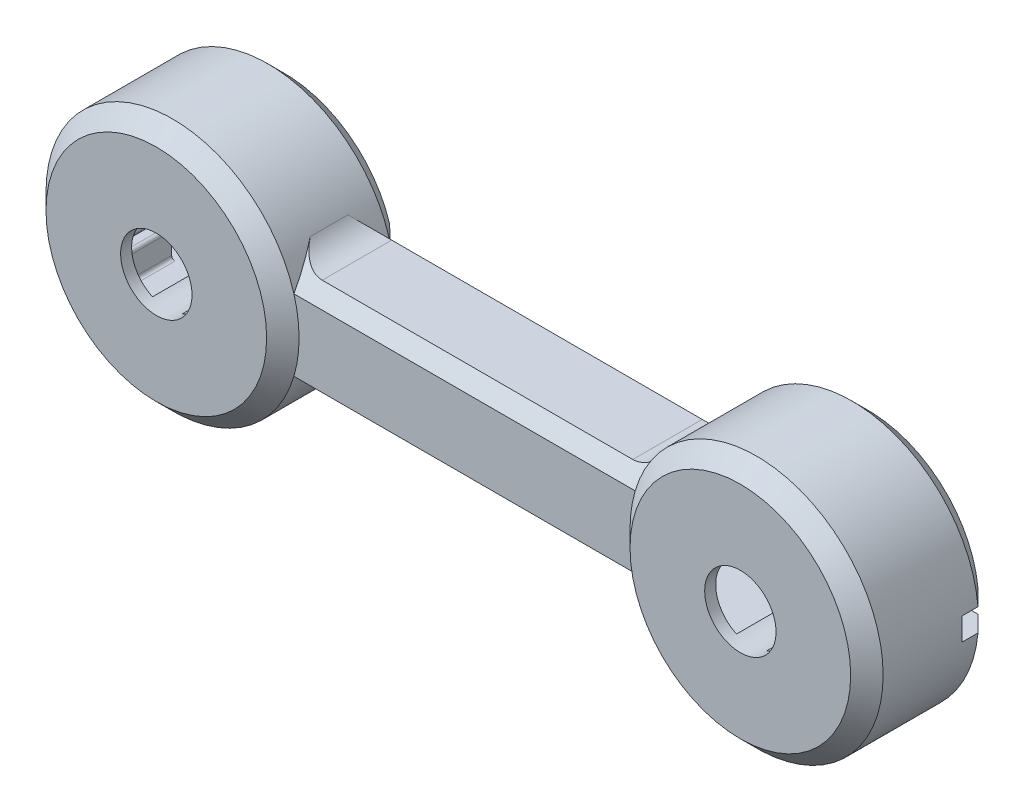
from build123d import *

# Parameters (mm, degrees)
SKETCH1_R               = 11
BOSS_EXTRUDE1_DEPTH     = 29.4
SKETCH2_R               = 11
BOSS_EXTRUDE2_DEPTH     = 5
SKETCH4_W               = 71
SKETCH4_H               = 20
CUT_EXTRUDE1_DEPTH      = 18
SKETCH5_R               = 2.25
CUT_EXTRUDE2_DEPTH      = 5
BOSS_EXTRUDE3_START     = 5
BOSS_EXTRUDE3_DEPTH     = 5
CUT_EXTRUDE3_DEPTH      = 106.704115341
CUT_EXTRUDE3_DEPTH_BACK = 10
CHAMFER1_SIZE           = 4
FILLET2_R               = 10
CUT_EXTRUDE4_DEPTH      = 13
FILLET3_R               = 1
SKETCH11_R              = 1.5
CUT_EXTRUDE5_DEPTH      = 10


with BuildPart() as part:
    # Sketch1 → Boss-Extrude1 (new body)
    with BuildSketch(Plane.XY):
        with BuildLine():
            Line((36, -15), (90, -15))
            Line((90, -15), (90, 15))
            Line((90, 15), (36, 15))
            ThreePointArc((36, 15), (-39, 0), (36, -15))
        make_face()
        Circle(SKETCH1_R, mode=Mode.SUBTRACT)
    extrude(amount=BOSS_EXTRUDE1_DEPTH)

    # Sketch2 → Boss-Extrude2 (add)
    with BuildSketch(Plane.XY.offset(29.4)):
        with BuildLine():
            ThreePointArc((36, 15), (-39, 0), (36, -15))
            ThreePointArc((36, -15), (39, 0), (36, 15))
        make_face()
        Circle(SKETCH2_R, mode=Mode.SUBTRACT)
    extrude(amount=BOSS_EXTRUDE2_DEPTH)

    # Sketch4 → Cut-Extrude1 (cut)
    with BuildSketch(Plane(origin=(0, 0, 0), x_dir=(-1, 0, 0), z_dir=(0, 0, -1))):
        with Locations((-7.5, 0)):
            Rectangle(SKETCH4_W, SKETCH4_H)
    extrude(amount=-CUT_EXTRUDE1_DEPTH, mode=Mode.SUBTRACT)

    # Sketch5 → Cut-Extrude2 (cut)
    with BuildSketch(Plane(origin=(0, 0, 18), x_dir=(-1, 0, 0), z_dir=(0, 0, -1))):
        with Locations((-34.85, 5)):
            Circle(SKETCH5_R)
        with Locations(Location((14.65, 5, 0), (0, 0, 180))):
            Circle(SKETCH5_R)
        with Locations((14.65, -5)):
            Circle(SKETCH5_R)
        with Locations(Location((-34.85, -5, 0), (0, 0, 180))):
            Circle(SKETCH5_R)
    extrude(amount=-CUT_EXTRUDE2_DEPTH, mode=Mode.SUBTRACT)

    # Sketch8 → Boss-Extrude3 (add)
    with BuildSketch(Plane(origin=(0, 0, 0), x_dir=(-1, 0, 0), z_dir=(0, 0, -1)).offset(BOSS_EXTRUDE3_START)):
        with BuildLine():
            Line((-4.582575695, -10), (-37.69615365, -10))
            ThreePointArc((-37.69615365, -10), (-36.932787137, -12.528736341), (-36, -15))
            ThreePointArc((-36, -15), (39, 0), (-36, 15))
            ThreePointArc((-36, 15), (-36.932787137, 12.528736341), (-37.69615365, 10))
            Line((-37.69615365, 10), (-4.582575695, 10))
            ThreePointArc((-4.582575695, 10), (0, 11), (4.582575695, 10))
            Line((4.582575695, 10), (28, 10))
            Line((28, 10), (28, -10))
            Line((28, -10), (4.582575695, -10))
            ThreePointArc((4.582575695, -10), (0, -11), (-4.582575695, -10))
        make_face()
    extrude(amount=-BOSS_EXTRUDE3_DEPTH)

    # Sketch9 → Cut-Extrude3 (cut, two sides: drawn at the far end of the back side and taken through both)
    with BuildSketch(Plane(origin=(0, 0, -5), x_dir=(-1, 0, 0), z_dir=(0, 0, -1)).offset(-CUT_EXTRUDE3_DEPTH_BACK)):
        with BuildLine():
            Line((38.842631219, 3.5), (28, 3.5))
            Line((28, 3.5), (28, -3.5))
            Line((28, -3.5), (38.842631219, -3.5))
            ThreePointArc((38.842631219, -3.5), (39, 0), (38.842631219, 3.5))
        make_face()
    extrude(amount=CUT_EXTRUDE3_DEPTH + CUT_EXTRUDE3_DEPTH_BACK, mode=Mode.SUBTRACT)

    # Sketch7 → Cut-Revolve1 (revolve, cut)
    with BuildSketch(Plane(origin=(0, 0, 0), x_dir=(1, 0, 0), z_dir=(0, 1, 0)), mode=Mode.PRIVATE) as cut_revolve1_sk:
        Polygon((-39, 0), (-34, 5), (-39, 5), align=None)
        Polygon((-39, -29.4), (-34, -34.4), (-39, -34.4), align=None)
    revolve(cut_revolve1_sk.sketch.rotate(Axis((0, 0, 0), (0, 0, 1)), 65.380022671), axis=Axis((0, 0, 0), (0, 0, 1)), mode=Mode.SUBTRACT)

    # Chamfer1
    # the kernel refuses this chamfer: 4 mm, written as the material it takes off along each edge
    with BuildSketch(Plane(origin=(25.713268048, -15, 29.4), x_dir=(0, -0.027495876610586487, -0.9996219169112968), z_dir=(1, 0, 0))) as chamfer1_piece_1_section:
        Polygon((CHAMFER1_SIZE * 0.999621916911, CHAMFER1_SIZE * 0.0274958766106), (-CHAMFER1_SIZE * 0.0274958766106, CHAMFER1_SIZE * 0.999621916911), (0, 0), align=None)
    chamfer1_piece_1 = extrude(amount=74.573463904, mode=Mode.PRIVATE)
    chamfer1_piece_1 = chamfer1_piece_1 - Plane(origin=(0, 0, 27.397501545), x_dir=(0.9230769230769231, 0.3846153846153848, 0), z_dir=(0, 0, -1)) * Cylinder(39, 166, mode=Mode.PRIVATE)
    add(chamfer1_piece_1, mode=Mode.SUBTRACT)
    with BuildSketch(Plane(origin=(100.286731952, 15, 29.4), x_dir=(0, -0.9996219169112968, 0.027495876610586487), z_dir=(-1, 0, 0))) as chamfer1_piece_2_section:
        Polygon((CHAMFER1_SIZE * 0.999621916911, -CHAMFER1_SIZE * 0.0274958766106), (-CHAMFER1_SIZE * 0.0274958766106, -CHAMFER1_SIZE * 0.999621916911), (0, 0), align=None)
    chamfer1_piece_2 = extrude(amount=74.573463904, mode=Mode.PRIVATE)
    chamfer1_piece_2 = chamfer1_piece_2 - Plane(origin=(0, 0, 28.081840344), x_dir=(0.9230769230769231, 0.3846153846153848, 0), z_dir=(0, 0, -1)) * Cylinder(39, 166, mode=Mode.PRIVATE)
    add(chamfer1_piece_2, mode=Mode.SUBTRACT)
    with BuildSketch(Plane(origin=(25.713268048, -15, 0), x_dir=(0, -0.027495876610586494, 0.9996219169112968), z_dir=(1, 0, 0))) as chamfer1_piece_3_section:
        Polygon((CHAMFER1_SIZE * 0.999621916911, -CHAMFER1_SIZE * 0.0274958766106), (-CHAMFER1_SIZE * 0.0274958766106, -CHAMFER1_SIZE * 0.999621916911), (0, 0), align=None)
    chamfer1_piece_3 = extrude(amount=74.573463904, mode=Mode.PRIVATE)
    chamfer1_piece_3 = chamfer1_piece_3 - Plane(origin=(0, 0, 2.002498455), x_dir=(0.9230769230769231, 0.3846153846153848, 0), z_dir=(0, 0, -1)) * Cylinder(39, 166, mode=Mode.PRIVATE)
    add(chamfer1_piece_3, mode=Mode.SUBTRACT)
    with BuildSketch(Plane(origin=(100.286731952, 15, 0), x_dir=(0, 0.027495876610586494, 0.9996219169112968), z_dir=(-1, 0, 0))) as chamfer1_piece_4_section:
        Polygon((CHAMFER1_SIZE * 0.999621916911, -CHAMFER1_SIZE * 0.0274958766106), (-CHAMFER1_SIZE * 0.0274958766106, -CHAMFER1_SIZE * 0.999621916911), (0, 0), align=None)
    chamfer1_piece_4 = extrude(amount=74.573463904, mode=Mode.PRIVATE)
    chamfer1_piece_4 = chamfer1_piece_4 - Plane(origin=(0, 0, 1.318159656), x_dir=(0.9230769230769231, 0.3846153846153848, 0), z_dir=(0, 0, -1)) * Cylinder(39, 166, mode=Mode.PRIVATE)
    add(chamfer1_piece_4, mode=Mode.SUBTRACT)

    # Fillet2
    fillet2_edges = [part.edges().sort_by_distance(p)[0] for p in [
        (36, 15, 14.7),
        (36, -15, 14.7),
    ]]
    fillet(fillet2_edges, radius=FILLET2_R)

    # Sketch10 → Cut-Extrude4 (cut)
    with BuildSketch(Plane(origin=(0, 0, 18), x_dir=(-1, 0, 0), z_dir=(0, 0, -1))):
        Polygon((11.65, 10), (-32.35, 10), (-32.35, 1.5), (-37.35, 1.5), (-37.35, -1.5), (-32.35, -1.5), (-32.35, -10), (11.65, -10), (11.65, -1.5), (16.65, -1.5), (16.65, 1.5), (11.65, 1.5), align=None)
    extrude(amount=-CUT_EXTRUDE4_DEPTH, mode=Mode.SUBTRACT)

    # Fillet3
    fillet3_edges = [part.edges().sort_by_distance(p)[0] for p in [
        (-11.65, -10, 24.5),
        (32.35, 10, 24.5),
        (-11.65, 10, 24.5),
        (-11.65, 1.5, 24.5),
        (-16.65, 1.5, 24.5),
        (-16.65, -1.5, 24.5),
        (-11.65, -1.5, 24.5),
        (32.35, -10, 24.5),
        (32.35, -1.5, 24.5),
        (37.35, -1.5, 24.5),
        (37.35, 1.5, 24.5),
        (32.35, 1.5, 24.5),
        (-28, -10, 6.5),
        (43, 10, 9),
        (-28, 10, 6.5),
        (43, -10, 9),
    ]]
    fillet(fillet3_edges, radius=FILLET3_R)

    # Sketch11 → Cut-Extrude5 (cut)
    with BuildSketch(Plane(origin=(0, 0, -5), x_dir=(-1, 0, 0), z_dir=(0, 0, -1))):
        with Locations((0, 27.5)):
            Circle(SKETCH11_R)
        with Locations((23.815698604, 13.75)):
            Circle(SKETCH11_R)
        with Locations((23.815698604, -13.75)):
            Circle(SKETCH11_R)
        with Locations((0, -27.5)):
            Circle(SKETCH11_R)
        with Locations((-23.815698604, -13.75)):
            Circle(SKETCH11_R)
        with Locations((-23.815698604, 13.75)):
            Circle(SKETCH11_R)
        with Locations((-52.5, 0)):
            Circle(SKETCH11_R)
    extrude(amount=-CUT_EXTRUDE5_DEPTH, mode=Mode.SUBTRACT)

    # Mirror4: part across plane


with BuildPart() as part_1:
    add(part.part)
    add(part.part.mirror(Plane(origin=(90, 15, 29.4), x_dir=(0, 0, 1), z_dir=(-1, 0, 0))))


solid = part_1.part
